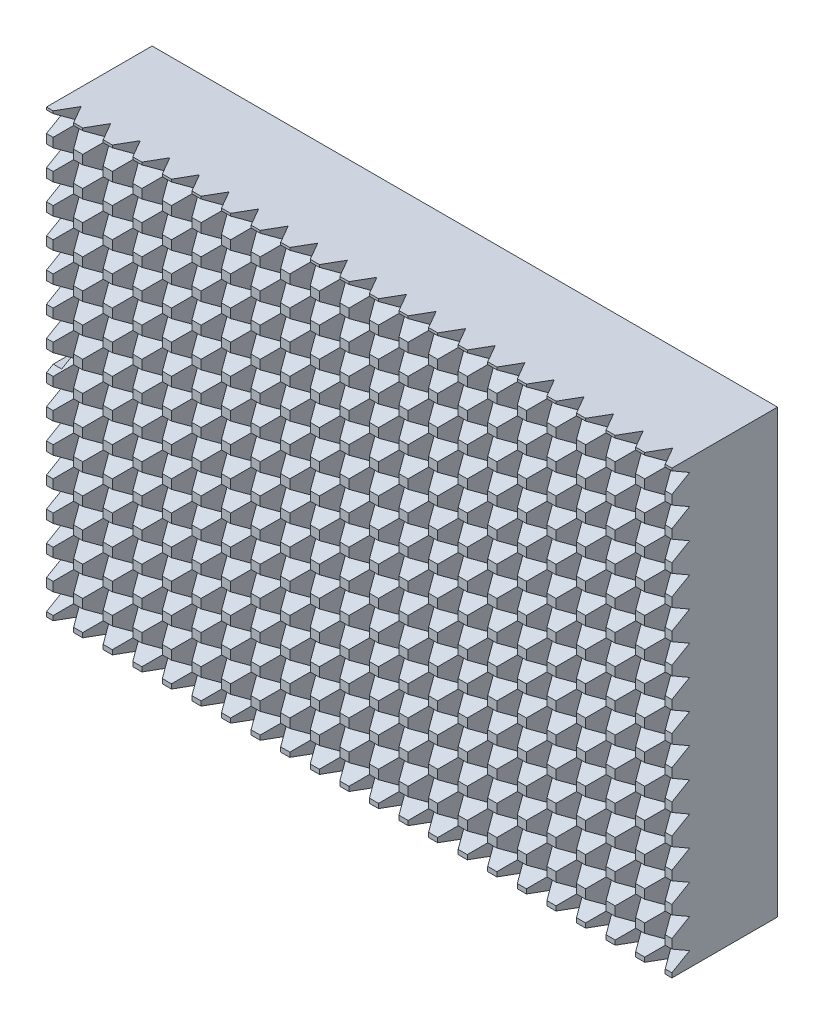
from build123d import *

# Parameters (mm, degrees)
SKETCH_1_W          = 148
SKETCH_1_H          = 25
EXTRUDE_1_DEPTH     = 105
CUT_EXTRUDE_1_DEPTH = 100
CUT_EXTRUDE_2_DEPTH = 105
CUT_EXTRUDE_3_DEPTH = 148
CUT_EXTRUDE_4_DEPTH = 2
SKETCH_6_W          = 25
SKETCH_6_H          = 0.5
CUT_EXTRUDE_5_DEPTH = 500


with BuildPart() as part:
    # 草图1 → 凸台-拉伸1 (new body)
    with BuildSketch(Plane(origin=(0, 0, 0), x_dir=(1, 0, 0), z_dir=(0, 1, 0))):
        with Locations((74, 12.5)):
            Rectangle(SKETCH_1_W, SKETCH_1_H)
    extrude(amount=EXTRUDE_1_DEPTH)

    # 草图2 → 切除-拉伸1 (cut)
    with BuildSketch(Plane.ZY):
        with BuildLine():
            ThreePointArc((-10, 34.02), (-7.892821792, 34.892821792), (-7.02, 37))
            ThreePointArc((-7.02, 37), (-12.107178208, 39.107178208), (-10, 34.02))
        make_face()
    extrude(amount=-CUT_EXTRUDE_1_DEPTH, mode=Mode.SUBTRACT)

    # 草图3 → 切除-拉伸2 (cut)
    with BuildSketch(Plane.XZ):
        Polygon((140, 1), (137, -4.196152423), (134, 1), align=None)
        Polygon((147, 1), (141, 1), (144, -4.196152423), align=None)
        Polygon((133, 1), (130, -4.196152423), (127, 1), align=None)
        Polygon((126, 1), (123, -4.196152423), (120, 1), align=None)
        Polygon((119, 1), (116, -4.196152423), (113, 1), align=None)
        Polygon((112, 1), (109, -4.196152423), (106, 1), align=None)
        Polygon((105, 1), (102, -4.196152423), (99, 1), align=None)
        Polygon((98, 1), (95, -4.196152423), (92, 1), align=None)
        Polygon((91, 1), (88, -4.196152423), (85, 1), align=None)
        Polygon((84, 1), (81, -4.196152423), (78, 1), align=None)
        Polygon((77, 1), (74, -4.196152423), (71, 1), align=None)
        Polygon((70, 1), (67, -4.196152423), (64, 1), align=None)
        Polygon((63, 1), (60, -4.196152423), (57, 1), align=None)
        Polygon((56, 1), (53, -4.196152423), (50, 1), align=None)
        Polygon((49, 1), (46, -4.196152423), (43, 1), align=None)
        Polygon((42, 1), (39, -4.196152423), (36, 1), align=None)
        Polygon((35, 1), (32, -4.196152423), (29, 1), align=None)
        Polygon((28, 1), (25, -4.196152423), (22, 1), align=None)
        Polygon((21, 1), (18, -4.196152423), (15, 1), align=None)
        Polygon((14, 1), (11, -4.196152423), (8, 1), align=None)
        Polygon((7, 1), (4, -4.196152423), (1, 1), align=None)
    extrude(amount=-CUT_EXTRUDE_2_DEPTH, mode=Mode.SUBTRACT)

    # 草图4 → 切除-拉伸3 (cut)
    with BuildSketch(Plane.ZY):
        Polygon((0, 1.577350269), (0, 6.422649731), (-4.196152423, 4), align=None)
        Polygon((0, 8.577350269), (0, 13.422649731), (-4.196152423, 11), align=None)
        Polygon((0, 15.577350269), (0, 20.422649731), (-4.196152423, 18), align=None)
        Polygon((0, 22.577350269), (0, 27.422649731), (-4.196152423, 25), align=None)
        Polygon((0, 29.577350269), (0, 34.422649731), (-4.196152423, 32), align=None)
        Polygon((0, 36.577350269), (0, 41.422649731), (-4.196152423, 39), align=None)
        Polygon((0, 43.577350269), (0, 48.422649731), (-4.196152423, 46), align=None)
        Polygon((0, 50.577350269), (0, 55.422649731), (-4.196152423, 53), align=None)
        Polygon((0, 57.577350269), (0, 62.422649731), (-4.196152423, 60), align=None)
        Polygon((0, 64.577350269), (0, 69.422649731), (-4.196152423, 67), align=None)
        Polygon((0, 71.577350269), (0, 76.422649731), (-4.196152423, 74), align=None)
        Polygon((0, 78.577350269), (0, 83.422649731), (-4.196152423, 81), align=None)
        Polygon((0, 85.577350269), (0, 90.422649731), (-4.196152423, 88), align=None)
        Polygon((0, 92.577350269), (0, 97.422649731), (-4.196152423, 95), align=None)
        Polygon((0, 99.577350269), (0, 104.422649731), (-4.196152423, 102), align=None)
    extrude(amount=-CUT_EXTRUDE_3_DEPTH, mode=Mode.SUBTRACT)

    # 草图5 → 切除-拉伸4 (cut)
    with BuildSketch(Plane.ZY):
        Polygon((-17.5, 53.5), (0, 53.5), (0, 51.5), (-25, 51.5), (-25, 53.5), align=None)
    extrude(amount=-CUT_EXTRUDE_4_DEPTH, mode=Mode.SUBTRACT)

    # 草图6 → 切除-拉伸5 (cut)
    with BuildSketch(Plane.ZY):
        with Locations((-12.5, 0.25)):
            Rectangle(SKETCH_6_W, SKETCH_6_H)
    extrude(amount=-CUT_EXTRUDE_5_DEPTH, mode=Mode.SUBTRACT)


solid = part.part
